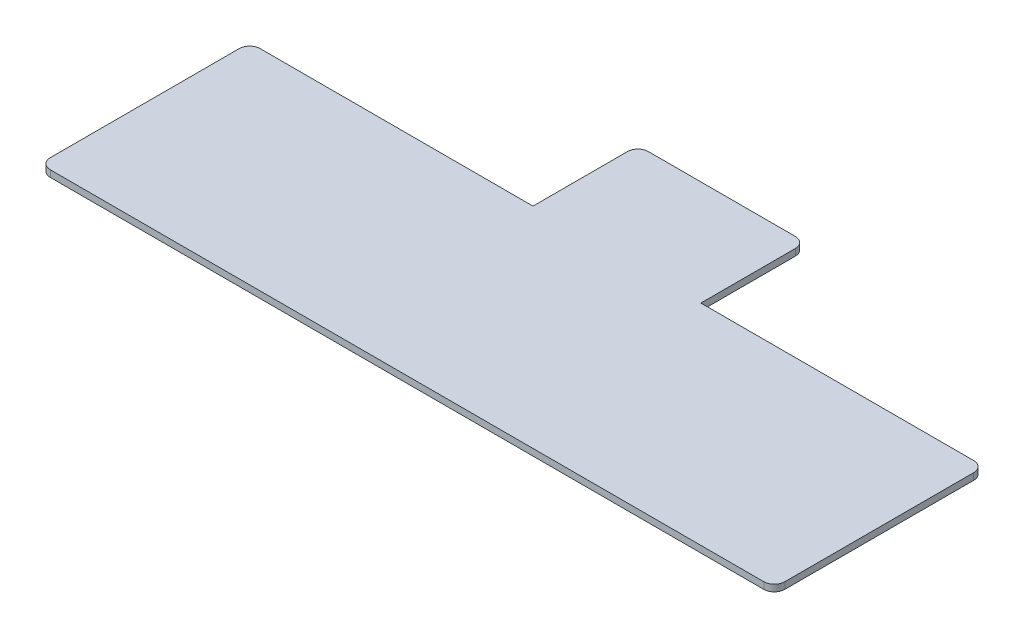
from build123d import *

# Parameters (mm, degrees)
BASE_FLANGE1_DEPTH = 3.175
FILLET1_R          = 5


# Sheet-metal steps are written as plain solids
with BuildPart() as part:
    # Sketch1 → Base-Flange1 (new body)
    with BuildSketch(Plane(origin=(0, 0, 0), x_dir=(1, 0, 0), z_dir=(0, 1, 0))):
        Polygon((215, 100), (350, 100), (350, 0), (0, 0), (0, 100), (135, 100), (135, 150), (215, 150), align=None)
    extrude(amount=-BASE_FLANGE1_DEPTH)

    # Fillet1
    fillet1_edges = [part.edges().sort_by_distance(p)[0] for p in [
        (0, -1.5875, -100),
        (135, -1.5875, -150),
        (215, -1.5875, -150),
        (350, -1.5875, -100),
        (350, -1.5875, 0),
        (0, -1.5875, 0),
    ]]
    fillet(fillet1_edges, radius=FILLET1_R)


solid = part.part
